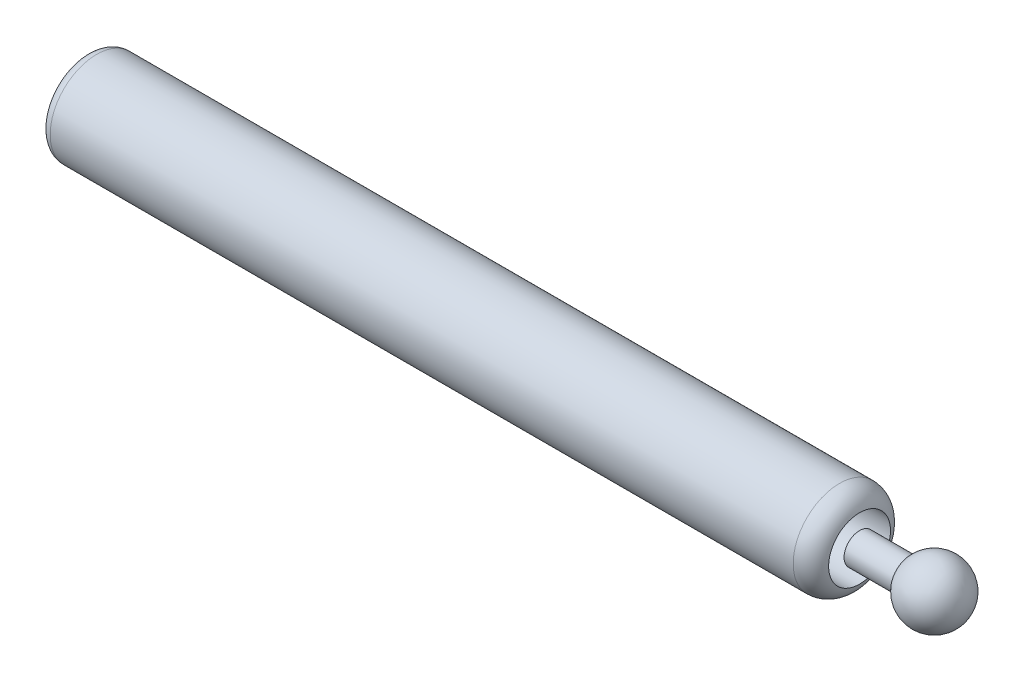
from build123d import *

# Parameters (mm, degrees)
SKETCH2_R           = 4.5
BOSS_EXTRUDE1_DEPTH = 75
SKETCH3_R           = 3
CUT_EXTRUDE1_DEPTH  = 100
SKETCH4_R           = 1.5
BOSS_EXTRUDE2_DEPTH = 5
FILLET1_R           = 2
FILLET3_R           = 1


with BuildPart() as part:
    # Sketch2 → Boss-Extrude1 (new body)
    with BuildSketch(Plane(origin=(0, 0, 0), x_dir=(0, 0, -1), z_dir=(1, 0, 0))):
        Circle(SKETCH2_R)
    extrude(amount=BOSS_EXTRUDE1_DEPTH)

    # Sketch3 → Cut-Extrude1 (cut)
    with BuildSketch(Plane.ZY):
        Circle(SKETCH3_R)
    extrude(amount=-CUT_EXTRUDE1_DEPTH, mode=Mode.SUBTRACT)

    # Fillet1
    # the kernel refuses this fillet: 2 mm, written as the material it takes off along each edge
    with BuildSketch(Plane(origin=(75, 0, 0), x_dir=(0, 0, -1), z_dir=(0, -1, 0))) as fillet1_piece_1:
        with BuildLine():
            CenterArc((2.5, -1.936491673), FILLET1_R, 0, 75.522487814)
            Line((3, 0), (3.01, 0.038729833))
            ThreePointArc((3.01, 0.038729833), (3.75, 0.04), (4.5, 0.04))
            Line((4.5, 0.04), (4.54, 0))
            Line((4.54, 0), (4.54, -1.936491673))
            Line((4.54, -1.936491673), (4.5, -1.936491673))
        make_face()
    revolve(axis=Axis((75, 0, 0), (1, 0, 0)), mode=Mode.SUBTRACT)

    # Fillet3
    fillet3_edges = [part.edges().sort_by_distance(p)[0] for p in [
        (0, 0, 4.5),
    ]]
    fillet(fillet3_edges, radius=FILLET3_R)


with BuildPart() as body_2:
    # Sketch4 → Boss-Extrude2 (new body)
    with BuildSketch(Plane(origin=(75, 0, 0), x_dir=(0, 0, -1), z_dir=(1, 0, 0))):
        Circle(SKETCH4_R)
    extrude(amount=BOSS_EXTRUDE2_DEPTH)

    # Sketch5 → Revolve1 (revolve)
    with BuildSketch(Plane(origin=(0, 0, 0), x_dir=(1, 0, 0), z_dir=(0, 1, 0))):
        with BuildLine():
            Line((80, 0), (82.25, 0))
            Line((82.25, 0), (85.25, 0))
            ThreePointArc((85.25, 0), (82.25, 3), (79.25, 0))
            Line((79.25, 0), (79.5, 0))
            Line((79.5, 0), (80, 0))
        make_face()
    revolve(axis=Axis((82.25, 0, 0), (1, 0, 0)))


solid = Compound([part.part, body_2.part])
